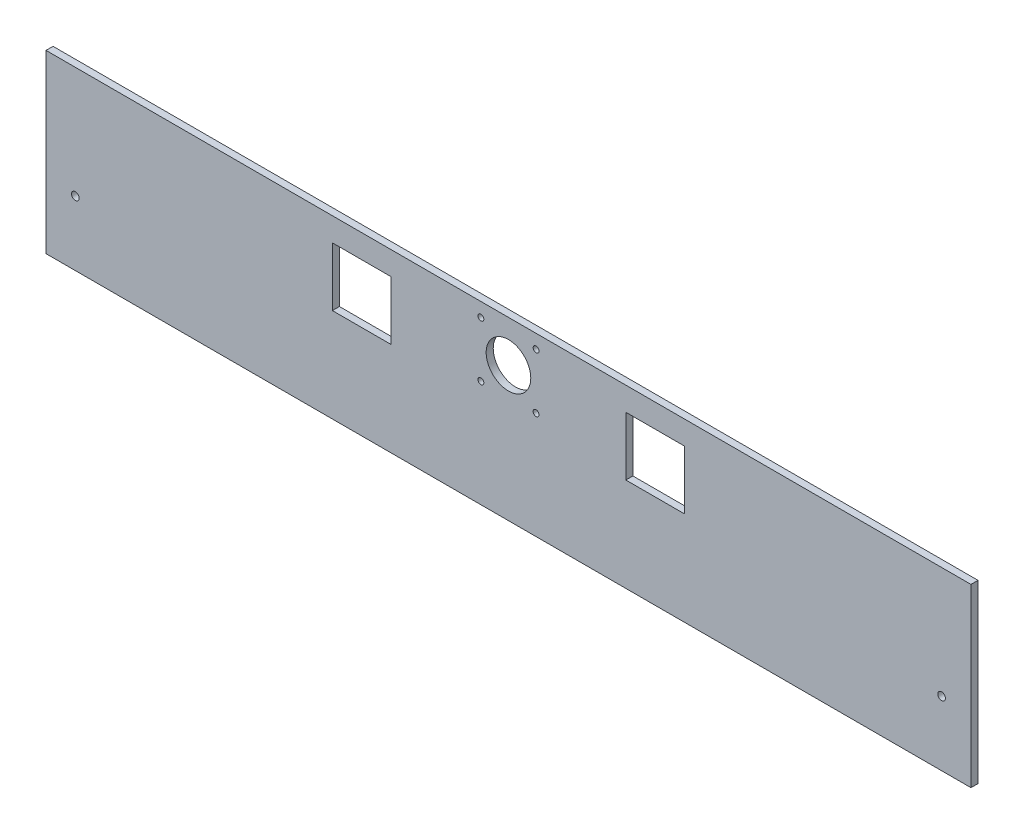
from build123d import *

# Parameters (mm, degrees)
SKETCH1_W          = 788
SKETCH1_H          = 150
BASE_FLANGE1_DEPTH = 6
SKETCH2_W          = 50
SKETCH2_H          = 50
CUT_EXTRUDE1_DEPTH = 402.119682888
SKETCH3_R          = 19
SKETCH3_R_2        = 2.5
CUT_EXTRUDE2_DEPTH = 10
SKETCH4_R          = 3.25
CUT_EXTRUDE3_DEPTH = 10


# Sheet-metal steps are written as plain solids
with BuildPart() as part:
    # Sketch1 → Base-Flange1 (new body)
    with BuildSketch(Plane.XY):
        Rectangle(SKETCH1_W, SKETCH1_H)
    extrude(amount=-BASE_FLANGE1_DEPTH)

    # Sketch2 → Cut-Extrude1 (cut, through all)
    with BuildSketch(Plane.XY):
        with Locations((-125, 30)):
            Rectangle(SKETCH2_W, SKETCH2_H)
        with Locations((125, 30)):
            Rectangle(SKETCH2_W, SKETCH2_H)
    extrude(amount=-CUT_EXTRUDE1_DEPTH, mode=Mode.SUBTRACT)

    # Sketch3 → Cut-Extrude2 (cut)
    with BuildSketch(Plane.XY):
        with Locations((0, 39.65)):
            Circle(SKETCH3_R)
        with Locations((23.5, 63.15)):
            Circle(SKETCH3_R_2)
        with Locations((23.5, 16.15)):
            Circle(SKETCH3_R_2)
        with Locations((-23.5, 16.15)):
            Circle(SKETCH3_R_2)
        with Locations((-23.5, 63.15)):
            Circle(SKETCH3_R_2)
    extrude(amount=-CUT_EXTRUDE2_DEPTH, mode=Mode.SUBTRACT)

    # Sketch4 → Cut-Extrude3 (cut)
    with BuildSketch(Plane.XY):
        with Locations((369, -20)):
            Circle(SKETCH4_R)
        with Locations((-369, -20)):
            Circle(SKETCH4_R)
    extrude(amount=-CUT_EXTRUDE3_DEPTH, mode=Mode.SUBTRACT)


solid = part.part
